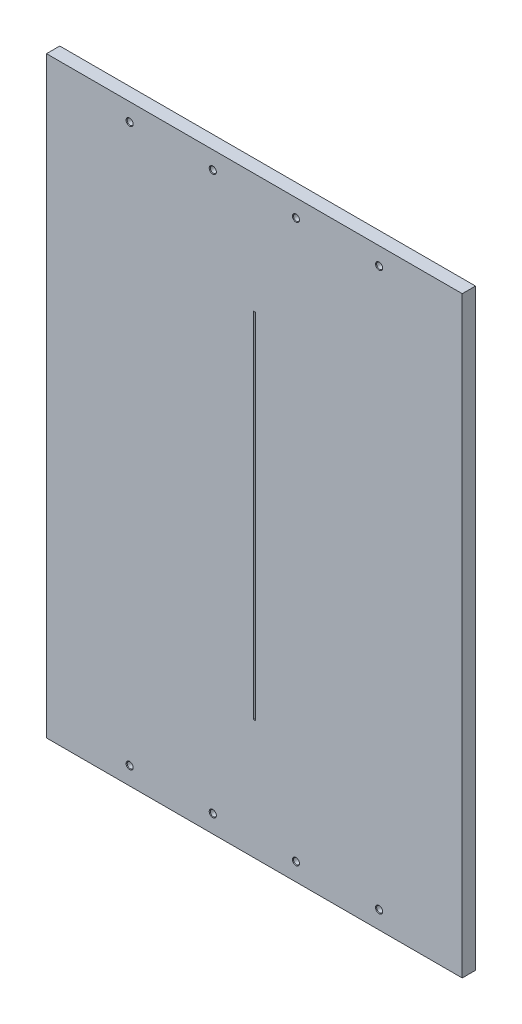
from build123d import *

# Parameters (mm, degrees)
SCHIZZO1_W                      = 470
SCHIZZO1_H                      = 670
ESTRUSIONE_ESTRUSIONE1_DEPTH    = 15
FORO_FILETTATO_M8_1_D           = 6.8
FORO_FILETTATO_M8_1_DEPTH       = 22.25
FORO_FILETTATO_M8_1_CSINK_D     = 8.05
FORO_FILETTATO_M8_1_CSINK_ANGLE = 90
FORO_FILETTATO_M8_1_TIP         = 2.042926105
SCHIZZO11_W                     = 2
SCHIZZO11_H                     = 400
TAGLIO_ESTRUSIONE1_DEPTH        = 5


with BuildPart() as part:
    # Schizzo1 → Estrusione-Estrusione1 (new body)
    with BuildSketch(Plane.XY):
        Rectangle(SCHIZZO1_W, SCHIZZO1_H)
    extrude(amount=ESTRUSIONE_ESTRUSIONE1_DEPTH)

    # Foro filettato M8-1
    with Locations(Plane.XY.offset(15)):
        with Locations((-141, 315), (-47, 315), (47, 315), (141, 315), (-141, -315), (-47, -315), (141, -315), (47, -315)):
            CounterSinkHole(FORO_FILETTATO_M8_1_D / 2, FORO_FILETTATO_M8_1_CSINK_D / 2, depth=FORO_FILETTATO_M8_1_DEPTH, counter_sink_angle=FORO_FILETTATO_M8_1_CSINK_ANGLE)
            with Locations((0, 0, -(FORO_FILETTATO_M8_1_DEPTH + FORO_FILETTATO_M8_1_TIP / 2))):  # 118° drill point
                Cone(0, FORO_FILETTATO_M8_1_D / 2, FORO_FILETTATO_M8_1_TIP, mode=Mode.SUBTRACT)

    # Schizzo11 → Taglio-Estrusione1 (cut)
    with BuildSketch(Plane.XY.offset(15)):
        Rectangle(SCHIZZO11_W, SCHIZZO11_H)
    extrude(amount=-TAGLIO_ESTRUSIONE1_DEPTH, mode=Mode.SUBTRACT)


solid = part.part
